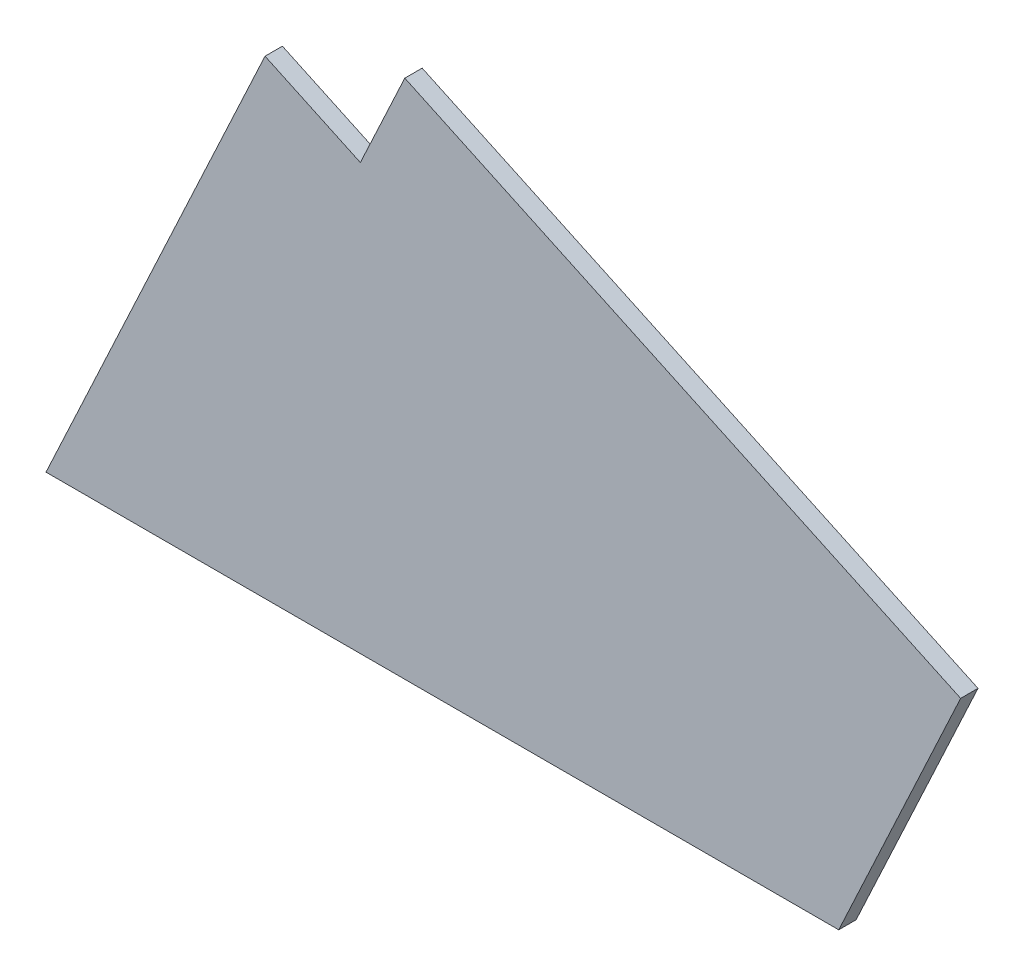
from build123d import *

# Parameters (mm, degrees)
BOSS_EXTRUDE1_DEPTH = 3.3


with BuildPart() as part:
    # Sketch1 → Boss-Extrude1 (new body)
    with BuildSketch(Plane.XY.offset(396.7)):
        Polygon((-327.437834123, 0), (-176.668895948, 0), (-153.484392838, 49.719327367), (-259.198908878, 99.014815774), (-267.651274112, 80.888660034), (-285.777429853, 89.341025269), align=None)
    extrude(amount=-BOSS_EXTRUDE1_DEPTH)


solid = part.part
